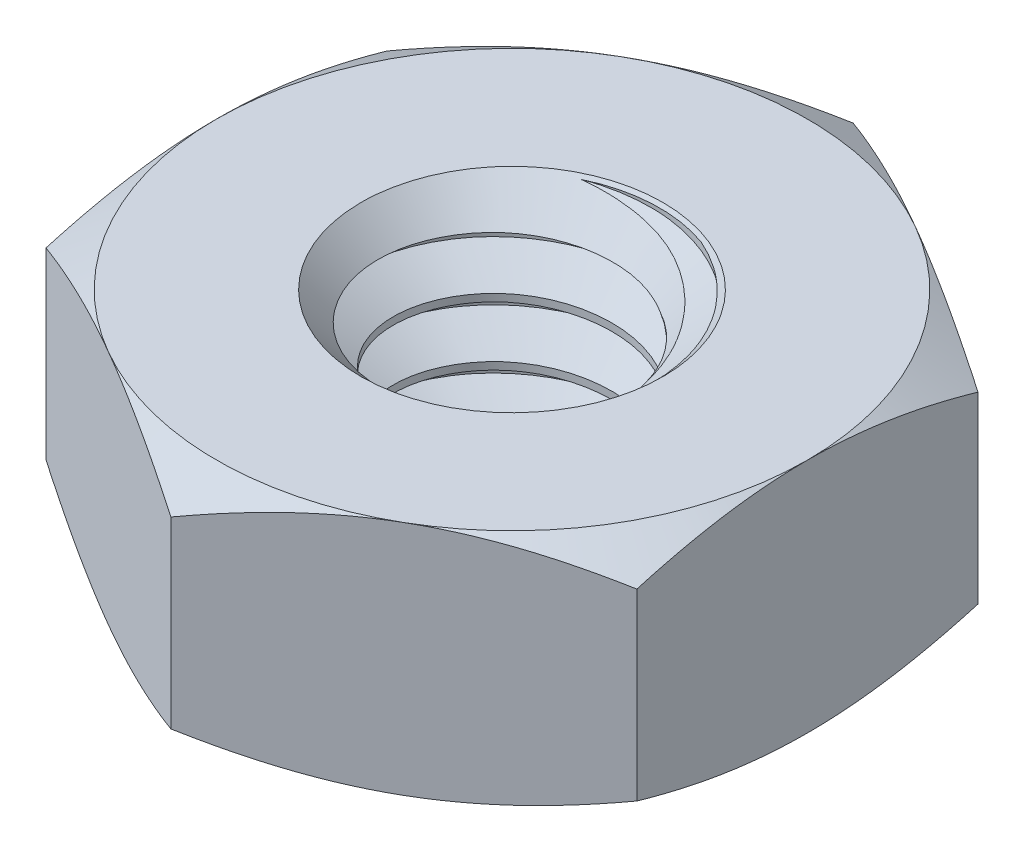
from build123d import *
from OCP.BRepAlgoAPI import BRepAlgoAPI_Cut
from OCP.TopTools import TopTools_ListOfShape

# Parameters (mm, degrees)
SKETCH1_R               = 1
BOSS_EXTRUDE1_DEPTH     = 0.8
SKETCH5_OUTSIDE_W       = 22.674
SKETCH5_OUTSIDE_H       = 23.292
SKETCH5_OUTSIDE_R       = 2
CUT_EXTRUDE2_DEPTH      = 4.448671241700684
CUT_EXTRUDE2_DRAFT      = -60.000000000000135
MIRROR1_COPY_1_SKETCH_W = 22.674
MIRROR1_COPY_1_SKETCH_H = 23.292
MIRROR1_COPY_1_SKETCH_R = 2
MIRROR1_COPY_1_DEPTH    = 4.448671241700684
MIRROR1_COPY_1_DRAFT    = -60.000000000000135
SWEEP1_PITCH            = 0.39999999999999963
SWEEP1_HEIGHT           = 2.0000000000000018
SWEEP1_RADIUS           = 1
SWEEP1_START_ANGLE      = -4.2554e-13
SKETCH4_R               = 1.021650635094611
CUT_EXTRUDE1_DEPTH      = 4.658345307183759


with BuildPart() as part:
    # Sketch1 → Boss-Extrude1 (new, symmetric)
    with BuildSketch(Plane(origin=(0, 0, 0), x_dir=(1, 0, 0), z_dir=(0, 1, 0))):
        Polygon((-2, 1.1547005383792524), (-2, -1.154700538379251), (-4.4e-16, -2.309401076758503), (1.9999999999999996, -1.1547005383792504), (1.9999999999999996, 1.1547005383792526), (-4e-16, 2.3094010767585043), align=None)
        with Locations(Location((0, 0, 0), (0, 0, 270))):
            Circle(SKETCH1_R, mode=Mode.SUBTRACT)
    extrude(amount=BOSS_EXTRUDE1_DEPTH, both=True)


with BuildPart() as cut_extrude2_tool:
    # Sketch5 outside → Cut-Extrude2 (with draft: the straight prism first)
    with BuildSketch(Plane(origin=(0, 0.8, 0), x_dir=(1, 0, 0), z_dir=(0, 1, 0))):
        Rectangle(SKETCH5_OUTSIDE_W, SKETCH5_OUTSIDE_H)
        Circle(SKETCH5_OUTSIDE_R, mode=Mode.SUBTRACT)
    extrude(amount=-CUT_EXTRUDE2_DEPTH)
    # Cut-Extrude2: the draft: its side faces are tilted about the plane it starts from
    cut_extrude2_sides = [cut_extrude2_tool.faces().sort_by_distance(p)[0] for p in [
        (0, -1.424335621, 11.646),
        (11.337, -1.424335621, 0),
        (0, -1.424335621, -11.646),
        (-11.337, -1.424335621, 0),
        (-2, -1.424335621, 0),
    ]]
    draft(cut_extrude2_sides, Plane(origin=(0, 0.8, 0), x_dir=(1, 0, 0), z_dir=(0, 1, 0)), CUT_EXTRUDE2_DRAFT)


with BuildPart() as part_1:
    add(part.part)

    # Cut-Extrude2: cut by cut_extrude2_tool
    add(cut_extrude2_tool.part, mode=Mode.SUBTRACT)


with BuildPart() as mirror1_copy_1_tool:
    # Mirror1 copy 1 sketch → Mirror1 copy 1 (with draft: the straight prism first)
    with BuildSketch(Plane.XZ.offset(0.8)):
        Rectangle(MIRROR1_COPY_1_SKETCH_W, MIRROR1_COPY_1_SKETCH_H)
        Circle(MIRROR1_COPY_1_SKETCH_R, mode=Mode.SUBTRACT)
    extrude(amount=-MIRROR1_COPY_1_DEPTH)
    # Mirror1 copy 1: the draft: its side faces are tilted about the plane it starts from
    mirror1_copy_1_sides = [mirror1_copy_1_tool.faces().sort_by_distance(p)[0] for p in [
        (0, 1.424335621, 11.646),
        (11.337, 1.424335621, 0),
        (0, 1.424335621, -11.646),
        (-11.337, 1.424335621, 0),
        (-2, 1.424335621, 0),
    ]]
    draft(mirror1_copy_1_sides, Plane.XZ.offset(0.8), MIRROR1_COPY_1_DRAFT)


with BuildPart() as part_2:
    add(part_1.part)

    # Mirror1 copy 1: cut by mirror1_copy_1_tool
    add(mirror1_copy_1_tool.part, mode=Mode.SUBTRACT)

    # Sweep1: sweep along a helix
    with BuildLine() as sweep1_path:
        add(Helix(SWEEP1_PITCH, SWEEP1_HEIGHT, SWEEP1_RADIUS, center=(0, 0.8, 0), direction=(0, -1, 0), mode=Mode.PRIVATE).rotate(Axis((0, 0.8, 0), (0, -1, 0)), SWEEP1_START_ANGLE))
    # Sketch3 → Sweep1 (sweep)
    with BuildSketch(Plane(origin=(0, 0, 0), x_dir=(0, 0, -1), z_dir=(1, 0, 0))):
        Polygon((0.7401923788646646, 0.9500000000000027), (0.7401923788646646, 1.0000000000000027), (1.021650635094611, 1.1625000000000048), (1.021650635094611, 0.7875000000000002), align=None)
    sweep(path=sweep1_path.line, is_frenet=True)

    # Sketch4 → Cut-Extrude1 (cut)
    with BuildSketch(Plane(origin=(0, 0.8, 0), x_dir=(1, 0, 0), z_dir=(0, 1, 0))):
        Circle(SKETCH4_R)
    extrude(amount=CUT_EXTRUDE1_DEPTH, mode=Mode.SUBTRACT)

    # Cut-Extrude1 cone 1 section (through the dimple's axis) → Cut-Extrude1 other way (revolve, cut)
    with BuildSketch(Plane(origin=(0, 0.8, 0), x_dir=(0, 0, 1), z_dir=(1, 0, 0))):
        Polygon((0, 0), (1.021650635, 0), (0, 1.021650635), align=None)
    revolve(axis=Axis((0, 0.8, 0), (0, -1, 0)), mode=Mode.SUBTRACT)


with BuildPart() as mirror2_tool:
    # Mirror2: read off the stored shape, not the designer's step
    # Mirror2 outline → Mirror2 (revolve)
    with BuildSketch(Plane.XY):
        Polygon((1.021651087, -0.800000452), (0.740060631, -0.518409995), (0.740060631, -1.2125001), (1.021651087, -1.2125001), align=None)
    revolve(axis=Axis((0, 0, 0), (0, 1, 0)))


with BuildPart() as part_3:
    add(part_2.part)

    # Mirror2: cut by mirror2_tool, with a tolerance
    mirror2_stock = TopTools_ListOfShape()
    mirror2_stock.Append(part_3.part.wrapped)
    mirror2_tools = TopTools_ListOfShape()
    mirror2_tools.Append(mirror2_tool.part.wrapped)
    mirror2_cut = BRepAlgoAPI_Cut()
    mirror2_cut.SetArguments(mirror2_stock)
    mirror2_cut.SetTools(mirror2_tools)
    mirror2_cut.SetFuzzyValue(0.00001)
    mirror2_cut.Build()
    add(Compound.cast(mirror2_cut.Shape()).solids(), mode=Mode.REPLACE)


solid = part_3.part
